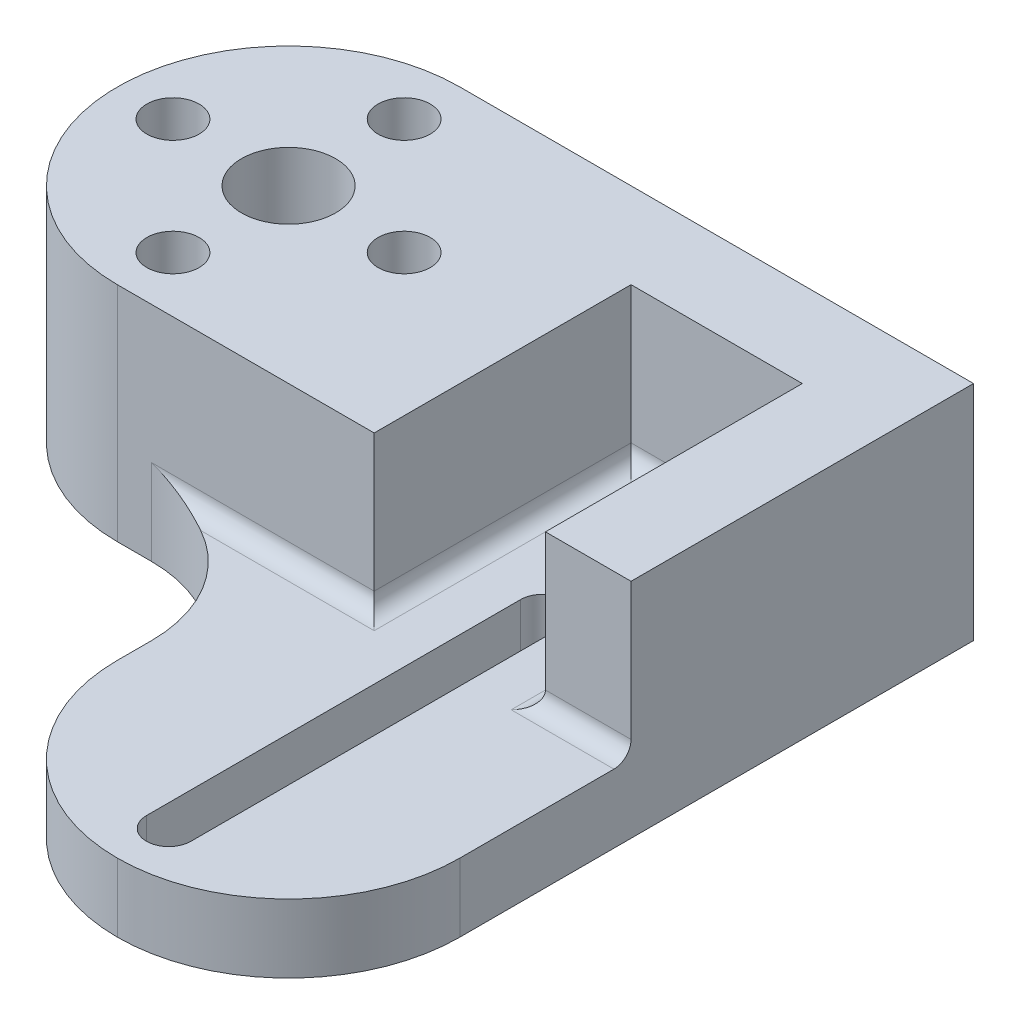
from build123d import *

# Parameters (mm, degrees)
SKETCH_1_R      = 1.525
SKETCH_1_R_2    = 2.75
EXTRUDE_1_DEPTH = 13
EXTRUDE_2_DEPTH = 4
FILLET_1_R      = 8
FILLET_2_R      = 1
FILLET_3_R      = 10


with BuildPart() as part:
    # 草图1 → 凸台-拉伸1 (new body)
    with BuildSketch(Plane(origin=(0, 0, 0), x_dir=(1, 0, 0), z_dir=(0, 1, 0))):
        with BuildLine():
            Line((-10, 0), (0, 0))
            Line((0, 0), (5, 0))
            Line((5, 0), (5, 15))
            Line((5, 15), (15, 15))
            Line((15, 15), (15, 0))
            Line((15, 0), (20, 0))
            Line((20, 0), (20, 20))
            Line((20, 20), (0, 20))
            Line((0, 20), (-10, 20))
            ThreePointArc((-10, 20), (-20, 10), (-10, 0))
        make_face()
        with Locations(Location((-10, 3.25, 0), (0, 0, 90))):
            Circle(SKETCH_1_R, mode=Mode.SUBTRACT)
        with Locations(Location((-16.75, 10, 0), (0, 0, 90))):
            Circle(SKETCH_1_R, mode=Mode.SUBTRACT)
        with Locations(Location((-10, 10, 0), (0, 0, 90))):
            Circle(SKETCH_1_R_2, mode=Mode.SUBTRACT)
        with Locations(Location((-10, 16.75, 0), (0, 0, 90))):
            Circle(SKETCH_1_R, mode=Mode.SUBTRACT)
        with Locations(Location((-3.25, 10, 0), (0, 0, 90))):
            Circle(SKETCH_1_R, mode=Mode.SUBTRACT)
    extrude(amount=EXTRUDE_1_DEPTH)

    # 草图1<3> → 凸台-拉伸2 (add)
    with BuildSketch(Plane(origin=(0, 0, 0), x_dir=(1, 0, 0), z_dir=(0, 1, 0))):
        Polygon((5, 0), (0, 0), (0, -20), (20, -20), (20, 0), (15, 0), (15, 15), (5, 15), align=None)
        with BuildLine():
            Line((8.7, -17), (8.7, 4.846192362))
            ThreePointArc((8.7, 4.846192362), (10, 6.146192362), (11.3, 4.846192362))
            Line((11.3, 4.846192362), (11.3, -17))
            ThreePointArc((11.3, -17), (10, -18.3), (8.7, -17))
        make_face(mode=Mode.SUBTRACT)
    extrude(amount=EXTRUDE_2_DEPTH)

    # 圆角1
    fillet_1_edges = [part.edges().sort_by_distance(p)[0] for p in [
        (0, 2, 0),
    ]]
    fillet(fillet_1_edges, radius=FILLET_1_R)

    # 圆角2
    fillet_2_edges = [part.edges().sort_by_distance(p)[0] for p in [
        (17.5, 4, 0),
        (15, 4, -7.5),
        (10, 4, -15),
        (5, 4, -7.5),
        (-1.5, 4, 0),
    ]]
    fillet(fillet_2_edges, radius=FILLET_2_R)

    # 圆角3
    fillet_3_edges = [part.edges().sort_by_distance(p)[0] for p in [
        (20, 2, 20),
        (0, 2, 20),
    ]]
    fillet(fillet_3_edges, radius=FILLET_3_R - 0.0001)  # a hair under: the kernel refuses the full size


solid = part.part
